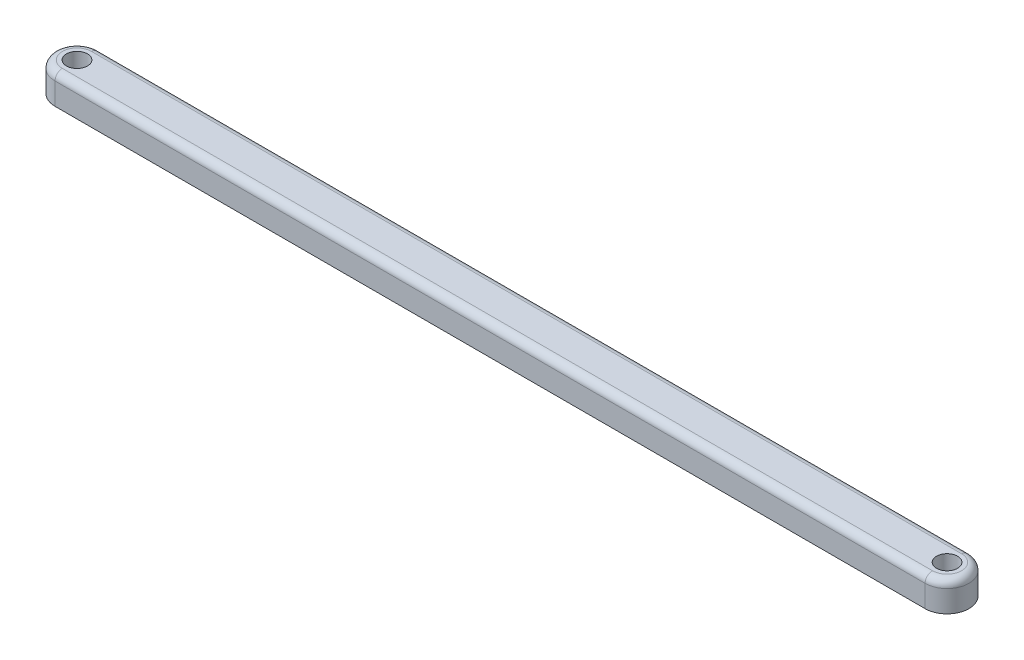
from build123d import *

# Parameters (mm, degrees)
BOSS_EXTRUDE1_DEPTH = 3.175
SKETCH2_R           = 2.286
CUT_EXTRUDE1_DEPTH  = 194.837585445
FILLET1_R           = 1.5875


with BuildPart() as part:
    # Sketch1 → Boss-Extrude1 (new, symmetric)
    with BuildSketch(Plane(origin=(0, 0, 0), x_dir=(1, 0, 0), z_dir=(0, 1, 0))):
        with BuildLine():
            Line((0, 4.7625), (188.9125, 4.7625))
            ThreePointArc((188.9125, 4.7625), (193.675, 0), (188.9125, -4.7625))
            Line((188.9125, -4.7625), (0, -4.7625))
            ThreePointArc((0, -4.7625), (-4.7625, 0), (0, 4.7625))
        make_face()
    extrude(amount=BOSS_EXTRUDE1_DEPTH, both=True)

    # Sketch2 → Cut-Extrude1 (cut, through all)
    with BuildSketch(Plane(origin=(0, 3.175, 0), x_dir=(1, 0, 0), z_dir=(0, 1, 0))):
        Circle(SKETCH2_R)
        with Locations((188.9125, 0)):
            Circle(SKETCH2_R)
    extrude(amount=-CUT_EXTRUDE1_DEPTH, mode=Mode.SUBTRACT)

    # Fillet1
    fillet1_edges = [part.edges().sort_by_distance(p)[0] for p in [
        (193.675, 3.175, 0),
        (94.45625, 3.175, 4.7625),
        (-4.7625, 3.175, 0),
        (94.45625, 3.175, -4.7625),
    ]]
    fillet(fillet1_edges, radius=FILLET1_R)


solid = part.part
